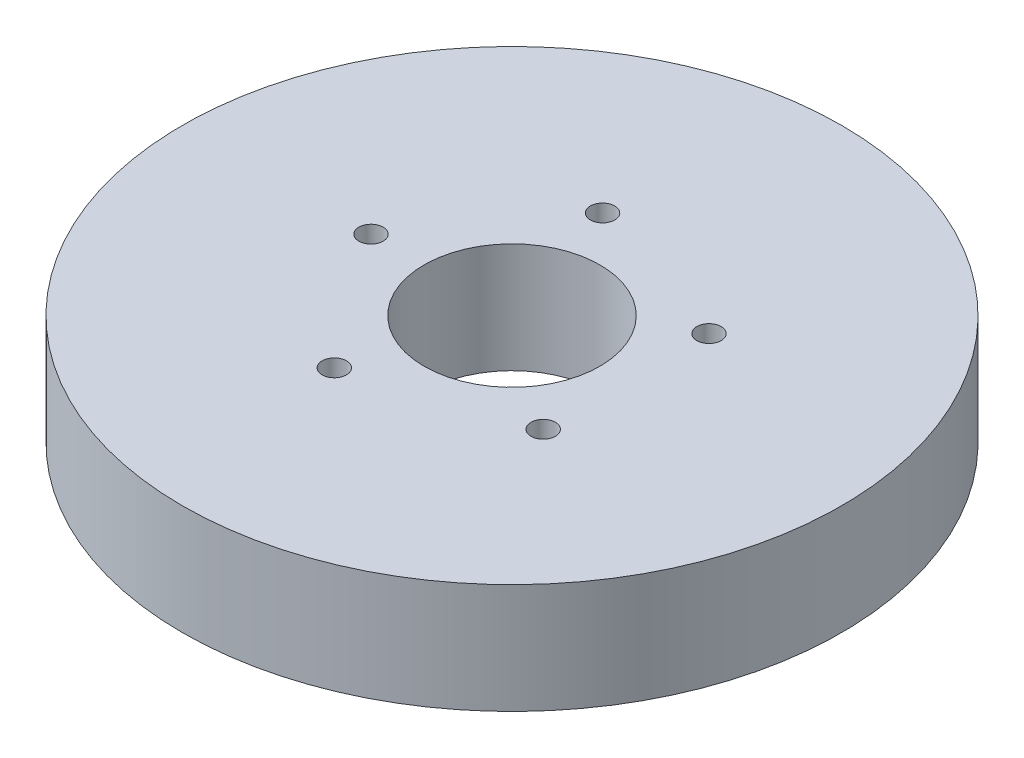
from build123d import *

# Parameters (mm, degrees)
SKETCH1_R           = 75
BOSS_EXTRUDE1_DEPTH = 25
SKETCH2_R           = 20
CUT_EXTRUDE1_DEPTH  = 109.972473589
SKETCH3_R           = 2.773848659
CUT_EXTRUDE2_DEPTH  = 20.364066762
CIRPATTERN1_COUNT   = 5


with BuildPart() as part:
    # Sketch1 → Boss-Extrude1 (new body)
    with BuildSketch(Plane(origin=(0, 0, 0), x_dir=(1, 0, 0), z_dir=(0, 1, 0))):
        Circle(SKETCH1_R)
    extrude(amount=BOSS_EXTRUDE1_DEPTH)

    # Sketch2 → Cut-Extrude1 (cut, through all)
    with BuildSketch(Plane(origin=(0, 0, 0), x_dir=(1, 0, 0), z_dir=(0, 1, 0))):
        Circle(SKETCH2_R)
    extrude(amount=CUT_EXTRUDE1_DEPTH, mode=Mode.SUBTRACT)

    # Sketch3 → Cut-Extrude2 (cut)
    with BuildSketch(Plane(origin=(0, 25, 0), x_dir=(1, 0, 0), z_dir=(0, 1, 0))):
        with Locations((-32.092928013, 0)):
            Circle(SKETCH3_R)
    cut_extrude2 = extrude(amount=-CUT_EXTRUDE2_DEPTH, mode=Mode.SUBTRACT)

    # CirPattern1: Cut-Extrude2 ×5 about axis
    cirpattern1_axis = Axis((0, 0, 0), (0, 1, 0))
    for i in range(1, CIRPATTERN1_COUNT):
        add(cut_extrude2.rotate(cirpattern1_axis, i * 360 / CIRPATTERN1_COUNT), mode=Mode.SUBTRACT)


solid = part.part
